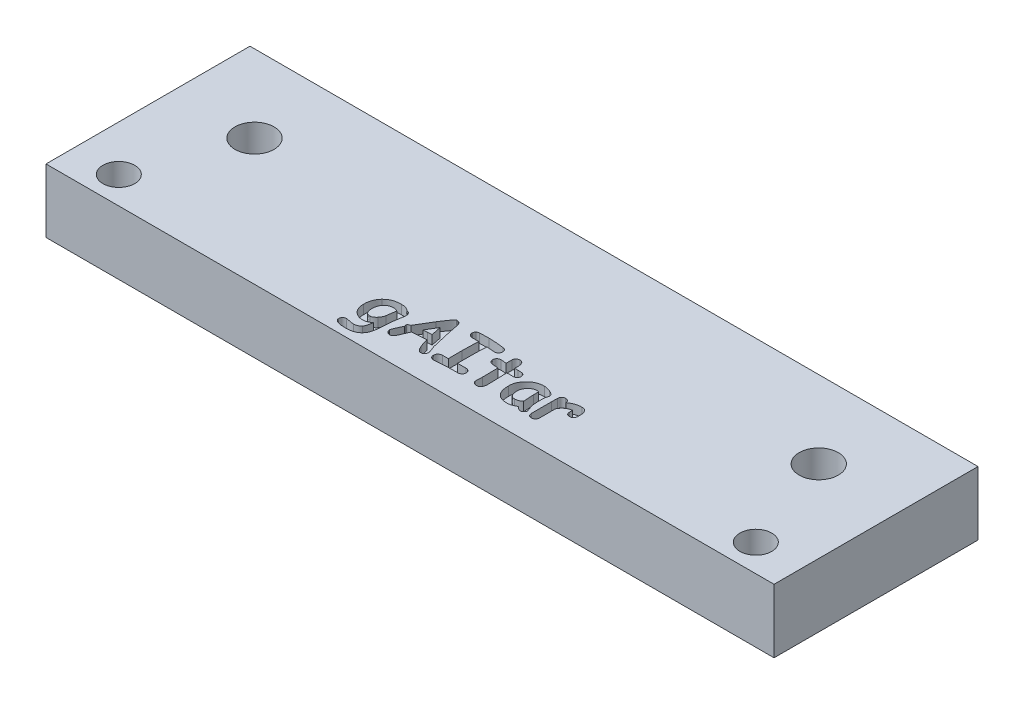
from build123d import *

# Parameters (mm, degrees)
SKETCH1_R           = 1.75
SKETCH1_R_2         = 2.15
BOSS_EXTRUDE1_DEPTH = 7
CUT_EXTRUDE1_DEPTH  = 1


with BuildPart() as part:
    # Sketch1 → Boss-Extrude1 (new body)
    with BuildSketch(Plane(origin=(0, 0, 0), x_dir=(1, 0, 0), z_dir=(0, 1, 0))):
        Polygon((13.670445698, -14.868638902), (-5.262861358, -14.868638902), (-5.262861358, -30.868638902), (-5.262861358, -37.280752379), (74.737138642, -37.280752379), (74.737138642, -14.868638902), (63.356369804, -14.868638902), align=None)
        with Locations((-0.262861358, -34.280752379)):
            Circle(SKETCH1_R, mode=Mode.SUBTRACT)
        with Locations((69.737138642, -34.280752379)):
            Circle(SKETCH1_R, mode=Mode.SUBTRACT)
        with Locations((3.737138642, -23.368638902)):
            Circle(SKETCH1_R_2, mode=Mode.SUBTRACT)
        with Locations((65.737138642, -23.368638902)):
            Circle(SKETCH1_R_2, mode=Mode.SUBTRACT)
    extrude(amount=-BOSS_EXTRUDE1_DEPTH)

    # Sketch2 → Cut-Extrude1 (cut)
    # profile 1 of 6: a face of its own
    with BuildSketch(Plane(origin=(0, 0, 0), x_dir=(1, 0, 0), z_dir=(0, 1, 0))):
        with BuildLine():
            add(Edge.make_bspline(
                [(28.877942793, -32.540894307), (28.854196843, -32.673953942), (28.806150163, -32.943181901), (28.756806812, -33.35489831), (28.717322684, -33.776893115), (28.705414659, -34.062125424), (28.699392645, -34.20637041)],
                knots=[0, 0, 0, 0, 0.967219611, 1.957036499, 2.966851822, 4, 4, 4, 4], degree=3))
            add(Edge.make_bspline(
                [(28.699392645, -34.20637041), (28.695835472, -34.293705449), (28.688967863, -34.462317677), (28.66700685, -34.705919532), (28.636730362, -34.931090951), (28.597753156, -35.138010913), (28.548415725, -35.32603197), (28.489788382, -35.495464519), (28.423852115, -35.647606206), (28.368742547, -35.738131355), (28.342292349, -35.781579494)],
                knots=[0, 0, 0, 0, 1.28398527, 2.478909032, 3.591840689, 4.620754995, 5.570443612, 6.444572228, 7.253462258, 8, 8, 8, 8], degree=3))
            add(Edge.make_bspline(
                [(28.342292349, -35.781579494), (28.304156717, -35.834120572), (28.228319149, -35.93860521), (28.08648839, -36.07296206), (27.924012281, -36.185281957), (27.741415791, -36.278633239), (27.537219472, -36.349224454), (27.31309504, -36.400339071), (27.06817942, -36.431391059), (26.898115345, -36.434597207), (26.809736912, -36.43626337)],
                knots=[0, 0, 0, 0, 0.894508824, 1.778844928, 2.680171894, 3.61283656, 4.600026264, 5.653829217, 6.780748383, 8, 8, 8, 8], degree=3))
            add(Edge.make_bspline(
                [(26.809736912, -36.43626337), (26.757822527, -36.435865226), (26.65726388, -36.435094018), (26.511633725, -36.429685898), (26.376108667, -36.418024576), (26.250493435, -36.40523917), (26.135011767, -36.386120244), (26.029697641, -36.363469033), (25.93389223, -36.337336662), (25.848744625, -36.305110889), (25.7722405, -36.271205713), (25.706915296, -36.231051948), (25.650032596, -36.188884639), (25.604453101, -36.140433156), (25.569924709, -36.087279093), (25.543039988, -36.031277274), (25.527858641, -35.970176707), (25.526080351, -35.928137653), (25.525167791, -35.906564597)],
                knots=[0, 0, 0, 0, 1.636202728, 3.169339922, 4.591200698, 5.922662832, 7.147586717, 8.277898332, 9.317111446, 10.273332431, 11.145263722, 11.949492425, 12.685250108, 13.370889905, 14.032756056, 14.676152522, 15.320645135, 16, 16, 16, 16], degree=3))
            add(Edge.make_bspline(
                [(25.525167791, -35.906564597), (25.526215877, -35.87629543), (25.528227825, -35.818189517), (25.551639504, -35.736146405), (25.585673774, -35.661923106), (25.636625425, -35.599198201), (25.697788314, -35.547064507), (25.769772825, -35.510032387), (25.85046819, -35.487192991), (25.907236411, -35.485091336), (25.936825077, -35.483995914)],
                knots=[0, 0, 0, 0, 1.091645385, 2.095566482, 3.063871764, 4.025877491, 4.993739444, 5.951348175, 6.932204115, 8, 8, 8, 8], degree=3))
            add(Edge.make_bspline(
                [(25.936825077, -35.483995914), (25.963638071, -35.484919846), (26.023093997, -35.4869686), (26.119754504, -35.499958035), (26.232260846, -35.519849823), (26.355963241, -35.548043262), (26.484090778, -35.575933949), (26.609257658, -35.595667814), (26.726478353, -35.608437094), (26.802102599, -35.610143535), (26.838503324, -35.610964908)],
                knots=[0, 0, 0, 0, 0.705402751, 1.564180905, 2.562339674, 3.710518732, 4.901234271, 6.010912507, 7.042579196, 8, 8, 8, 8], degree=3))
            add(Edge.make_bspline(
                [(26.838503324, -35.610964908), (26.877567932, -35.610011313), (26.953309544, -35.608162407), (27.062525339, -35.594017403), (27.164376647, -35.571929801), (27.25734991, -35.537443735), (27.344008004, -35.49628974), (27.421574401, -35.443913826), (27.492510687, -35.383376968), (27.531879254, -35.335510928), (27.551711971, -35.311397437)],
                knots=[0, 0, 0, 0, 1.167774304, 2.264175006, 3.288380824, 4.27673725, 5.223050921, 6.149949896, 7.067999611, 8, 8, 8, 8], degree=3))
            add(Edge.make_bspline(
                [(27.551711971, -35.311397437), (27.569896668, -35.285681108), (27.60765942, -35.232277999), (27.653002314, -35.141279861), (27.694315296, -35.040298892), (27.727996695, -34.928090612), (27.758259393, -34.805399974), (27.781516807, -34.671465868), (27.799232941, -34.52642129), (27.806731843, -34.425959905), (27.810609686, -34.37400916)],
                knots=[0, 0, 0, 0, 0.766248492, 1.591208865, 2.469199973, 3.42203185, 4.441793224, 5.54621718, 6.731096096, 8, 8, 8, 8], degree=3))
            add(Edge.make_bspline(
                [(27.810609686, -34.37400916), (27.782698885, -34.401695192), (27.727347747, -34.456600581), (27.636014673, -34.528050168), (27.538772831, -34.587668052), (27.437572584, -34.637986756), (27.330231435, -34.675859988), (27.218052679, -34.701888829), (27.10129262, -34.720035356), (27.021753856, -34.72145877), (26.981343443, -34.722181949)],
                knots=[0, 0, 0, 0, 1.018488561, 2.019809537, 2.997408571, 3.971054348, 4.944285044, 5.940088247, 6.953442572, 8, 8, 8, 8], degree=3))
            add(Edge.make_bspline(
                [(26.981343443, -34.722181949), (26.928715985, -34.720777789), (26.825393462, -34.718021028), (26.67399483, -34.698437024), (26.530566129, -34.66336396), (26.394723539, -34.615394255), (26.265617077, -34.555215108), (26.145466336, -34.478931655), (26.032337381, -34.389967924), (25.927914025, -34.28800268), (25.833018923, -34.176043267), (25.751475247, -34.054333172), (25.680007527, -33.926616585), (25.624071676, -33.789363081), (25.578603755, -33.64556891), (25.549151631, -33.493399956), (25.527776408, -33.334724057), (25.526047619, -33.226074351), (25.525167791, -33.170779552)],
                knots=[0, 0, 0, 0, 1.057394421, 2.07596308, 3.060530534, 4.018719327, 4.966765821, 5.91609184, 6.871743602, 7.853707326, 8.843885278, 9.815000739, 10.793294062, 11.779138416, 12.787821841, 13.818474559, 14.889762197, 16, 16, 16, 16], degree=3))
            add(Edge.make_bspline(
                [(25.525167791, -33.170779552), (25.526887554, -33.096306694), (25.530261295, -32.950209702), (25.556533664, -32.736791613), (25.59873183, -32.534061071), (25.659225728, -32.342452474), (25.738560907, -32.162235251), (25.832463145, -31.991635336), (25.944982803, -31.832194811), (26.033254821, -31.736816392), (26.077681305, -31.688813323)],
                knots=[0, 0, 0, 0, 1.100769952, 2.159433455, 3.17379743, 4.158601115, 5.124007861, 6.080262211, 7.033813857, 8, 8, 8, 8], degree=3))
            add(Edge.make_bspline(
                [(26.077681305, -31.688813323), (26.126623805, -31.642038529), (26.223993806, -31.54898113), (26.387583037, -31.429806694), (26.562833435, -31.327778035), (26.751348872, -31.245446265), (26.952265678, -31.18185141), (27.165544243, -31.136712361), (27.391232899, -31.108125262), (27.546002792, -31.105107959), (27.625115921, -31.103565616)],
                knots=[0, 0, 0, 0, 0.954478493, 1.898913427, 2.848073813, 3.811237561, 4.795497314, 5.816828307, 6.884036558, 8, 8, 8, 8], degree=3))
            add(Edge.make_bspline(
                [(27.625115921, -31.103565616), (27.675732098, -31.104560502), (27.773198918, -31.106476261), (27.914326626, -31.119895566), (28.044017457, -31.144722103), (28.1634328, -31.178290006), (28.271952343, -31.221458981), (28.369629058, -31.275733024), (28.45670153, -31.339917156), (28.506269461, -31.390857667), (28.530761949, -31.416028375)],
                knots=[0, 0, 0, 0, 1.230633783, 2.369715889, 3.441839262, 4.436769147, 5.381727131, 6.274208347, 7.147252447, 8, 8, 8, 8], degree=3))
            add(Edge.make_bspline(
                [(28.530761949, -31.416028375), (28.56412149, -31.42109757), (28.627553929, -31.430736535), (28.714583395, -31.46367469), (28.78972595, -31.506896655), (28.850939812, -31.564983183), (28.897308072, -31.636572375), (28.929698255, -31.720321457), (28.949743161, -31.81617478), (28.952092305, -31.884119952), (28.953330633, -31.91993657)],
                knots=[0, 0, 0, 0, 1.09924587, 2.090192013, 3.019932431, 3.913665009, 4.81822796, 5.78281411, 6.831232632, 8, 8, 8, 8], degree=3))
            add(Edge.make_bspline(
                [(28.953330633, -31.91993657), (28.952146673, -31.960964891), (28.949572935, -32.050153848), (28.93454218, -32.194803585), (28.910557112, -32.360819589), (28.889249419, -32.478466591), (28.877942793, -32.540894307)],
                knots=[0, 0, 0, 0, 0.786268973, 1.709222005, 2.784431082, 4, 4, 4, 4], degree=3))
        make_face()
        with BuildLine():
            add(Edge.make_bspline(
                [(27.56659115, -31.865379581), (27.520897879, -31.866438657), (27.432118229, -31.868496386), (27.302839553, -31.886893976), (27.181391398, -31.916335625), (27.06739643, -31.957997772), (26.961687428, -32.012408784), (26.862456622, -32.076515818), (26.772331692, -32.154971826), (26.719478595, -32.214911306), (26.69268737, -32.245294618)],
                knots=[0, 0, 0, 0, 1.111238106, 2.159077864, 3.169787664, 4.147162423, 5.104195285, 6.056958229, 7.015072484, 8, 8, 8, 8], degree=3))
            add(Edge.make_bspline(
                [(26.69268737, -32.245294618), (26.670222313, -32.274607183), (26.625110774, -32.333469041), (26.568683583, -32.430563617), (26.521696421, -32.533923157), (26.480705607, -32.642858454), (26.452158703, -32.758926344), (26.430185117, -32.880815208), (26.41555868, -33.00907014), (26.414495131, -33.097003963), (26.41395075, -33.142013139)],
                knots=[0, 0, 0, 0, 0.924915228, 1.857300009, 2.806547696, 3.768766156, 4.769746137, 5.797102952, 6.872440935, 8, 8, 8, 8], degree=3))
            add(Edge.make_bspline(
                [(26.41395075, -33.142013139), (26.414223247, -33.175091726), (26.414749831, -33.23901425), (26.421850576, -33.331757851), (26.433363121, -33.417972092), (26.450416552, -33.497773343), (26.471296862, -33.571312332), (26.495229735, -33.639403995), (26.526734343, -33.699997687), (26.561304149, -33.755246201), (26.600972494, -33.804231754), (26.645911755, -33.845995073), (26.695443236, -33.881633978), (26.750140152, -33.909882252), (26.808830778, -33.933163075), (26.87257302, -33.948767141), (26.940667904, -33.959026479), (26.987916632, -33.959913895), (27.012093746, -33.960367984)],
                knots=[0, 0, 0, 0, 1.37461971, 2.65637591, 3.863376246, 4.987402158, 6.044576246, 7.040288866, 7.980686288, 8.876649525, 9.745970185, 10.591946157, 11.419525468, 12.274054161, 13.144352013, 14.037676177, 14.995881405, 16, 16, 16, 16], degree=3))
            add(Edge.make_bspline(
                [(27.012093746, -33.960367984), (27.035019407, -33.959534524), (27.081094772, -33.957859458), (27.149436886, -33.940123073), (27.218547523, -33.915948552), (27.286972543, -33.879200372), (27.356099105, -33.833464902), (27.42382951, -33.775837691), (27.494234949, -33.711012696), (27.537326333, -33.660944897), (27.559647533, -33.635009936)],
                knots=[0, 0, 0, 0, 0.835668678, 1.679503976, 2.56600849, 3.506113926, 4.507836105, 5.588931544, 6.751074222, 8, 8, 8, 8], degree=3))
            add(Edge.make_bspline(
                [(27.559647533, -33.635009936), (27.599829018, -33.58478111), (27.676709488, -33.488676753), (27.763963056, -33.333776212), (27.828525089, -33.181333794), (27.846515602, -33.076726335), (27.855247223, -33.025955543)],
                knots=[0, 0, 0, 0, 1.123174621, 2.149004495, 3.101627094, 4, 4, 4, 4], degree=3))
            add(Edge.make_bspline(
                [(27.855247223, -33.025955543), (27.860580778, -32.996535701), (27.871897159, -32.934114644), (27.888912402, -32.834990839), (27.905600452, -32.724135401), (27.923143748, -32.602081561), (27.942567757, -32.468289936), (27.960799418, -32.323005644), (27.980794396, -32.166298982), (27.994157711, -32.058152502), (28.001063177, -32.002268027)],
                knots=[0, 0, 0, 0, 0.693869833, 1.47220668, 2.333871874, 3.295331016, 4.333835031, 5.471190016, 6.69324256, 8, 8, 8, 8], degree=3))
            add(Edge.make_bspline(
                [(28.001063177, -32.002268027), (27.964183764, -31.981414951), (27.892722474, -31.941007915), (27.781348127, -31.899037579), (27.673103957, -31.871040303), (27.601466585, -31.867233068), (27.56659115, -31.865379581)],
                knots=[0, 0, 0, 0, 1.102033903, 2.135412693, 3.092257404, 4, 4, 4, 4], degree=3))
        make_face(mode=Mode.SUBTRACT)
    # profile 2 of 6: a face of its own
    with BuildSketch(Plane(origin=(0, 0, 0), x_dir=(1, 0, 0), z_dir=(0, 1, 0))):
        with BuildLine():
            add(Edge.make_bspline(
                [(33.235558349, -34.658697452), (33.213085251, -34.655922999), (33.16579916, -34.650085219), (33.097271021, -34.615554786), (33.030235064, -34.561916936), (32.963029355, -34.489879395), (32.897121064, -34.398047027), (32.829245877, -34.288319318), (32.762560867, -34.158249172), (32.720891322, -34.063762617), (32.69891596, -34.013933028)],
                knots=[0, 0, 0, 0, 0.617601942, 1.299508468, 2.069050832, 2.967653557, 3.993005483, 5.166409531, 6.505642971, 8, 8, 8, 8], degree=3))
            add(Edge.make_bspline(
                [(32.69891596, -34.013933028), (32.668678952, -33.943492327), (32.606585779, -33.798838907), (32.526783724, -33.570030748), (32.450362887, -33.326862355), (32.407460463, -33.158114419), (32.385461256, -33.071585025)],
                knots=[0, 0, 0, 0, 0.92482678, 1.899176974, 2.922754564, 4, 4, 4, 4], degree=3))
            add(Edge.make_bspline(
                [(32.385461256, -33.071585025), (32.36363523, -33.073866414), (32.317005321, -33.078740457), (32.242399118, -33.087273102), (32.15832511, -33.093696494), (32.064713346, -33.100408642), (31.961646204, -33.109065639), (31.848457362, -33.115080095), (31.725875988, -33.123821145), (31.640851197, -33.127965678), (31.596864769, -33.130109796)],
                knots=[0, 0, 0, 0, 0.665943065, 1.422744785, 2.27850244, 3.224288394, 4.27088324, 5.416887377, 6.663661535, 8, 8, 8, 8], degree=3))
            add(Edge.make_bspline(
                [(31.596864769, -33.130109796), (31.516163053, -33.134731794), (31.364592773, -33.143412621), (31.152339007, -33.160602013), (30.970009215, -33.177564735), (30.858825843, -33.191993113), (30.808268282, -33.198554019)],
                knots=[0, 0, 0, 0, 1.225077394, 2.300884464, 3.227374231, 4, 4, 4, 4], degree=3))
            add(Edge.make_bspline(
                [(30.808268282, -33.198554019), (30.794828271, -33.233978441), (30.766337857, -33.309071865), (30.718530049, -33.427528059), (30.662480037, -33.557981144), (30.601285389, -33.702087319), (30.53283589, -33.85848883), (30.457418118, -34.027594291), (30.373912335, -34.208408395), (30.316260097, -34.333338097), (30.286505071, -34.397815847)],
                knots=[0, 0, 0, 0, 0.695126249, 1.473543035, 2.343390057, 3.300056381, 4.345961424, 5.475616407, 6.697134707, 8, 8, 8, 8], degree=3))
            add(Edge.make_bspline(
                [(30.286505071, -34.397815847), (30.274140753, -34.418677312), (30.250255572, -34.458977139), (30.206859834, -34.511721017), (30.161143903, -34.556843152), (30.111883342, -34.594654701), (30.058051877, -34.623098439), (30.001157607, -34.644437967), (29.940493029, -34.656515609), (29.899037255, -34.657958897), (29.877823621, -34.658697452)],
                knots=[0, 0, 0, 0, 1.138689991, 2.199702202, 3.200101217, 4.154635026, 5.107521665, 6.051873488, 7.003110107, 8, 8, 8, 8], degree=3))
            add(Edge.make_bspline(
                [(29.877823621, -34.658697452), (29.847572379, -34.657222098), (29.787753699, -34.654304741), (29.700873959, -34.629343161), (29.619184688, -34.588638315), (29.544140857, -34.533985775), (29.478779045, -34.467283044), (29.431795607, -34.388769825), (29.401991228, -34.301362121), (29.399175264, -34.240012953), (29.397722112, -34.208354301)],
                knots=[0, 0, 0, 0, 0.992623025, 1.962808613, 2.944427404, 3.978985964, 5.001144528, 5.990670065, 6.963104482, 8, 8, 8, 8], degree=3))
            add(Edge.make_bspline(
                [(29.397722112, -34.208354301), (29.398197287, -34.200064303), (29.399289314, -34.181012577), (29.406068315, -34.149684959), (29.414659948, -34.111812385), (29.428081742, -34.067922709), (29.444924592, -34.017313403), (29.46592299, -33.960277163), (29.489485224, -33.89656729), (29.517656287, -33.826942963), (29.549317512, -33.750524182), (29.585177114, -33.667735674), (29.62336015, -33.577940046), (29.667763538, -33.483015774), (29.714304145, -33.380811795), (29.763302797, -33.271443227), (29.818377864, -33.156924541), (29.855707718, -33.07821532), (29.874847786, -33.037858886)],
                knots=[0, 0, 0, 0, 0.314055115, 0.721748328, 1.210755772, 1.785277686, 2.458454997, 3.230882768, 4.086800385, 5.030877746, 6.075036811, 7.219431389, 8.447692371, 9.770074371, 11.187795077, 12.700857956, 14.30843697, 16, 16, 16, 16], degree=3))
            add(Edge.make_bspline(
                [(29.874847786, -33.037858886), (29.861734206, -33.004229741), (29.837071083, -32.940982345), (29.835776308, -32.87319704), (29.835169975, -32.841453723)],
                knots=[0, 0, 0, 0, 1.06341596, 2, 2, 2, 2], degree=3))
            add(Edge.make_bspline(
                [(29.835169975, -32.841453723), (29.83715775, -32.828046189), (29.841129712, -32.801255315), (29.859313247, -32.763472656), (29.88607645, -32.728030181), (29.921555436, -32.694707703), (29.96695822, -32.664724608), (30.020447717, -32.636274244), (30.083036467, -32.609314591), (30.128633408, -32.595024504), (30.15259246, -32.587515735)],
                knots=[0, 0, 0, 0, 0.752598618, 1.503839162, 2.308249816, 3.221830668, 4.204347205, 5.335203325, 6.599774453, 8, 8, 8, 8], degree=3))
            add(Edge.make_bspline(
                [(30.15259246, -32.587515735), (30.231423481, -32.447348907), (30.391344152, -32.162999259), (30.64431192, -31.736392074), (30.907176387, -31.300193503), (31.091084651, -31.009652482), (31.184215538, -30.862522916)],
                knots=[0, 0, 0, 0, 0.959952368, 1.947408831, 2.960570711, 4, 4, 4, 4], degree=3))
            add(Edge.make_bspline(
                [(31.184215538, -30.862522916), (31.217099316, -30.810494261), (31.280851486, -30.709625693), (31.376479011, -30.564934089), (31.466866571, -30.429774946), (31.551859782, -30.304473204), (31.630997039, -30.188204561), (31.707715618, -30.08399507), (31.777822594, -29.988270602), (31.843469979, -29.903090817), (31.903297517, -29.827123076), (31.960625012, -29.762915863), (32.01111064, -29.70684619), (32.058565988, -29.66274709), (32.098467449, -29.625147234), (32.136209533, -29.60111765), (32.168177992, -29.583842409), (32.188916016, -29.581125597), (32.1979836, -29.579937686)],
                knots=[0, 0, 0, 0, 1.78782162, 3.46607086, 5.037735172, 6.510873904, 7.864269361, 9.122617283, 10.269431075, 11.310632428, 12.246624243, 13.076963133, 13.810944874, 14.435907806, 14.959952405, 15.396829301, 15.736266982, 16, 16, 16, 16], degree=3))
            add(Edge.make_bspline(
                [(32.1979836, -29.579937686), (32.228198034, -29.581159141), (32.286434526, -29.583513421), (32.370152837, -29.604924833), (32.445134893, -29.641325836), (32.513508541, -29.690659032), (32.571711746, -29.755875543), (32.624379663, -29.832991266), (32.666444462, -29.92567341), (32.687746456, -29.992996635), (32.69891596, -30.028296947)],
                knots=[0, 0, 0, 0, 0.99262844, 1.913231282, 2.818023045, 3.720786198, 4.667487244, 5.678007641, 6.782484758, 8, 8, 8, 8], degree=3))
            add(Edge.make_bspline(
                [(32.69891596, -30.028296947), (32.704808779, -30.060050457), (32.717339507, -30.127572402), (32.738446869, -30.234255361), (32.760968037, -30.352749286), (32.787095376, -30.482232375), (32.814440867, -30.62323987), (32.845636158, -30.774852192), (32.878094052, -30.937984513), (32.901207691, -31.050344397), (32.913176138, -31.108525342)],
                knots=[0, 0, 0, 0, 0.703804664, 1.496598655, 2.369949713, 3.332312584, 4.375228356, 5.500107119, 6.705533268, 8, 8, 8, 8], degree=3))
            add(Edge.make_bspline(
                [(32.913176138, -31.108525342), (32.931074412, -31.190847205), (32.967518604, -31.358469722), (33.02229726, -31.614377957), (33.082692092, -31.87822508), (33.143880396, -32.151485062), (33.208234647, -32.433558163), (33.275678925, -32.724202097), (33.346362889, -33.023379985), (33.394566849, -33.225675147), (33.419068224, -33.328498849)],
                knots=[0, 0, 0, 0, 0.887984091, 1.808099605, 2.758450469, 3.740933003, 4.759716727, 5.808016423, 6.885846477, 8, 8, 8, 8], degree=3))
            add(Edge.make_bspline(
                [(33.419068224, -33.328498849), (33.421631011, -33.337782168), (33.427533411, -33.359162734), (33.439782742, -33.394788748), (33.455437577, -33.438193712), (33.476001602, -33.489502246), (33.499345643, -33.549067428), (33.526005027, -33.617173934), (33.558091525, -33.692290248), (33.580748465, -33.745119387), (33.592658645, -33.772890329)],
                knots=[0, 0, 0, 0, 0.484095073, 1.11492746, 1.893238178, 2.803918041, 3.893639273, 5.109913091, 6.480754429, 8, 8, 8, 8], degree=3))
            add(Edge.make_bspline(
                [(33.592658645, -33.772890329), (33.611160977, -33.81795666), (33.645239289, -33.90096158), (33.683228868, -34.018937349), (33.708323585, -34.118714237), (33.71272017, -34.180146899), (33.714667913, -34.207362355)],
                knots=[0, 0, 0, 0, 1.288345925, 2.372925573, 3.279185206, 4, 4, 4, 4], degree=3))
            add(Edge.make_bspline(
                [(33.714667913, -34.207362355), (33.713107891, -34.238663553), (33.710037989, -34.300259879), (33.681008737, -34.38806705), (33.633882952, -34.467791259), (33.570011706, -34.536479059), (33.495104561, -34.593193592), (33.412833497, -34.63309552), (33.325609111, -34.657783385), (33.265809255, -34.658390388), (33.235558349, -34.658697452)],
                knots=[0, 0, 0, 0, 1.02219752, 2.011540054, 2.991779931, 4.033789213, 5.062158375, 6.049782013, 7.01344477, 8, 8, 8, 8], degree=3))
        make_face()
        with BuildLine():
            add(Edge.make_bspline(
                [(31.962892572, -31.184905128), (31.940083643, -31.222933217), (31.8924824, -31.302296188), (31.817986798, -31.426228938), (31.738121758, -31.560303444), (31.650024121, -31.703115187), (31.557210217, -31.856796891), (31.458200348, -32.020249344), (31.352615291, -32.1934437), (31.280114464, -32.31209226), (31.242740309, -32.373255557)],
                knots=[0, 0, 0, 0, 0.765904334, 1.598409045, 2.497514132, 3.461292612, 4.496548288, 5.59840364, 6.761977782, 8, 8, 8, 8], degree=3))
            add(Edge.make_bspline(
                [(31.242740309, -32.373255557), (31.271493621, -32.369521639), (31.335515792, -32.36120769), (31.442240508, -32.349782814), (31.570071468, -32.343179353), (31.662336832, -32.338224774), (31.71193042, -32.335561637)],
                knots=[0, 0, 0, 0, 0.7389037, 1.645244125, 2.734294355, 4, 4, 4, 4], degree=3))
            add(Edge.make_bspline(
                [(31.71193042, -32.335561637), (31.742020216, -32.334258402), (31.799229947, -32.331780562), (31.880578357, -32.327958139), (31.953282168, -32.323562699), (32.0174642, -32.320972205), (32.073009618, -32.317910808), (32.1196502, -32.315151149), (32.157624746, -32.31181437), (32.180125964, -32.310396347), (32.190048038, -32.30977106)],
                knots=[0, 0, 0, 0, 1.509561724, 2.870129807, 4.081743534, 5.160108469, 6.089504161, 6.870000916, 7.50171875, 8, 8, 8, 8], degree=3))
            add(Edge.make_bspline(
                [(32.190048038, -32.30977106), (32.182709621, -32.272420168), (32.167519966, -32.195108246), (32.145162681, -32.074535266), (32.119121851, -31.94602406), (32.091177844, -31.809568376), (32.062888541, -31.664843101), (32.030304669, -31.512391009), (31.998591149, -31.35101844), (31.974964924, -31.241080431), (31.962892572, -31.184905128)],
                knots=[0, 0, 0, 0, 0.796061286, 1.647752555, 2.564499405, 3.538207678, 4.560733012, 5.648383233, 6.798388398, 8, 8, 8, 8], degree=3))
        make_face(mode=Mode.SUBTRACT)
    # profile 3 of 6: a face of its own
    with BuildSketch(Plane(origin=(0, 0, 0), x_dir=(1, 0, 0), z_dir=(0, 1, 0))):
        with BuildLine():
            add(Edge.make_bspline(
                [(37.268807804, -30.532205142), (37.252272893, -30.531957349), (37.213563435, -30.531377247), (37.146772385, -30.528022193), (37.062456369, -30.523051082), (36.960287926, -30.516013995), (36.840264568, -30.507044342), (36.702712621, -30.496141421), (36.54764323, -30.483177666), (36.438546891, -30.473712133), (36.38101679, -30.468720645)],
                knots=[0, 0, 0, 0, 0.445813027, 1.043681475, 1.802721911, 2.723031118, 3.80466259, 5.047648995, 6.443127856, 8, 8, 8, 8], degree=3))
            add(Edge.make_bspline(
                [(36.38101679, -30.468720645), (36.376156077, -30.522598524), (36.366024455, -30.634901029), (36.354963277, -30.809912687), (36.343193677, -30.99765482), (36.336312134, -31.198118174), (36.32846523, -31.41134925), (36.325478824, -31.637229366), (36.321910669, -31.87594946), (36.321639498, -32.039298856), (36.321500074, -32.12328535)],
                knots=[0, 0, 0, 0, 0.783875404, 1.633901941, 2.541011057, 3.50963479, 4.54033398, 5.632943764, 6.782972208, 8, 8, 8, 8], degree=3))
            Line((36.321500074, -32.12328535), (36.317532293, -33.642945499))
            add(Edge.make_bspline(
                [(36.317532293, -33.642945499), (36.469955875, -33.639805985), (36.777756784, -33.63346612), (37.085623028, -33.633173673), (37.241033336, -33.633026046)],
                knots=[0, 0, 0, 0, 0.990403717, 2, 2, 2, 2], degree=3))
            add(Edge.make_bspline(
                [(37.241033336, -33.633026046), (37.273952602, -33.634313678), (37.337511462, -33.636799774), (37.428256671, -33.662874302), (37.510319106, -33.704882895), (37.580640492, -33.764113391), (37.640839134, -33.832175579), (37.682604017, -33.910514288), (37.710622821, -33.99484723), (37.712982467, -34.054039225), (37.714191229, -34.084361142)],
                knots=[0, 0, 0, 0, 1.082052957, 2.089173409, 3.083186474, 4.097294582, 5.101700896, 6.05723862, 7.004793642, 8, 8, 8, 8], degree=3))
            add(Edge.make_bspline(
                [(37.714191229, -34.084361142), (37.712384579, -34.114283345), (37.708846495, -34.172882036), (37.683349659, -34.257990383), (37.63860033, -34.334810698), (37.578711728, -34.403060375), (37.507162885, -34.460949206), (37.42375185, -34.501921139), (37.33185584, -34.527882927), (37.267335467, -34.53042077), (37.23408972, -34.531728458)],
                knots=[0, 0, 0, 0, 0.981990313, 1.923098611, 2.885936941, 3.87867145, 4.890923925, 5.886267153, 6.910845923, 8, 8, 8, 8], degree=3))
            add(Edge.make_bspline(
                [(37.23408972, -34.531728458), (37.197717239, -34.531586157), (37.11703153, -34.53127049), (36.983795027, -34.534218824), (36.826380739, -34.535187935), (36.652825741, -34.540214935), (36.479540889, -34.542076832), (36.322506729, -34.54605818), (36.189569162, -34.546400648), (36.108892643, -34.54722703), (36.072521812, -34.547599582)],
                knots=[0, 0, 0, 0, 0.75140939, 1.666864596, 2.753078635, 4.003449207, 5.253689156, 6.333180816, 7.248559561, 8, 8, 8, 8], degree=3))
            add(Edge.make_bspline(
                [(36.072521812, -34.547599582), (36.052352937, -34.547909932), (36.009694024, -34.548566349), (35.941841258, -34.550043431), (35.86685545, -34.555864593), (35.784454403, -34.561235381), (35.69525761, -34.569813705), (35.598888357, -34.577943188), (35.495560077, -34.590778028), (35.387392638, -34.60291631), (35.279059053, -34.616227316), (35.175464927, -34.62655225), (35.079319224, -34.636881273), (34.990368407, -34.644856638), (34.908361434, -34.650975539), (34.833260272, -34.65453743), (34.765500093, -34.658090119), (34.722819012, -34.658502524), (34.702645399, -34.658697452)],
                knots=[0, 0, 0, 0, 0.704160305, 1.489359833, 2.368452763, 3.328943639, 4.371824874, 5.496213545, 6.704552097, 8.005941836, 9.295867175, 10.514415829, 11.63992951, 12.67131452, 13.631805396, 14.510216124, 15.295839695, 16, 16, 16, 16], degree=3))
            add(Edge.make_bspline(
                [(34.702645399, -34.658697452), (34.669399608, -34.657031214), (34.604816187, -34.653794375), (34.512162107, -34.627031563), (34.428642369, -34.582912294), (34.356267373, -34.521860117), (34.297152185, -34.449035927), (34.25324556, -34.367429026), (34.227883251, -34.277948244), (34.224348534, -34.216115975), (34.22254389, -34.184547614)],
                knots=[0, 0, 0, 0, 1.059674382, 2.058528156, 3.049994519, 4.054020422, 5.059487538, 6.027361096, 6.992872509, 8, 8, 8, 8], degree=3))
            add(Edge.make_bspline(
                [(34.22254389, -34.184547614), (34.224157438, -34.152595628), (34.227327377, -34.089823509), (34.255489115, -34.00011529), (34.299941485, -33.917330953), (34.362784832, -33.845175494), (34.437593343, -33.783191236), (34.524206432, -33.737670911), (34.620793103, -33.711439956), (34.687936917, -33.708132021), (34.722484304, -33.706429996)],
                knots=[0, 0, 0, 0, 0.992985397, 1.95079569, 2.900097383, 3.900955296, 4.911042762, 5.910628263, 6.924959263, 8, 8, 8, 8], degree=3))
            add(Edge.make_bspline(
                [(34.722484304, -33.706429996), (34.766460544, -33.706429996), (34.860695345, -33.706429996), (35.011801674, -33.706429996), (35.182085611, -33.706429996), (35.302110988, -33.706429996), (35.365264837, -33.706429996)],
                knots=[0, 0, 0, 0, 0.820987654, 1.759259259, 2.820987654, 4, 4, 4, 4], degree=3))
            add(Edge.make_bspline(
                [(35.365264837, -33.706429996), (35.364511819, -33.669067888), (35.362859295, -33.587075398), (35.362322094, -33.452491049), (35.361196517, -33.295104233), (35.360245326, -33.114569489), (35.359314094, -32.910890075), (35.358015335, -32.684397081), (35.358409471, -32.43475598), (35.358351518, -32.260835031), (35.35832122, -32.169906778)],
                knots=[0, 0, 0, 0, 0.5836817, 1.280910478, 2.102084751, 3.042040837, 4.100779199, 5.283464622, 6.57975812, 8, 8, 8, 8], degree=3))
            add(Edge.make_bspline(
                [(35.35832122, -32.169906778), (35.358866836, -32.017464216), (35.359945285, -31.716150158), (35.375043284, -31.269728718), (35.395669319, -30.833757721), (35.417802681, -30.547040105), (35.428749334, -30.405236148)],
                knots=[0, 0, 0, 0, 1.03546784, 2.04667918, 3.033932318, 4, 4, 4, 4], degree=3))
            Line((35.428749334, -30.405236148), (34.697685672, -30.405236148))
            add(Edge.make_bspline(
                [(34.697685672, -30.405236148), (34.665131956, -30.40376645), (34.602144129, -30.400922748), (34.51158525, -30.377218236), (34.428996951, -30.338461694), (34.357277453, -30.283619854), (34.296783195, -30.218506073), (34.253671242, -30.143151387), (34.227600026, -30.059725332), (34.224265293, -30.00170593), (34.22254389, -29.971756066)],
                knots=[0, 0, 0, 0, 1.087496504, 2.104184986, 3.108465136, 4.119361848, 5.105884215, 6.062056377, 6.999625195, 8, 8, 8, 8], degree=3))
            add(Edge.make_bspline(
                [(34.22254389, -29.971756066), (34.223877722, -29.941798043), (34.226477059, -29.883416636), (34.25227026, -29.800908996), (34.29358521, -29.726380659), (34.333240873, -29.686560614), (34.353480665, -29.666236924)],
                knots=[0, 0, 0, 0, 1.046658878, 2.039701267, 2.999486214, 4, 4, 4, 4], degree=3))
            add(Edge.make_bspline(
                [(34.353480665, -29.666236924), (34.374443248, -29.649260209), (34.416023906, -29.615585781), (34.488402012, -29.578471252), (34.567641076, -29.553408521), (34.623450452, -29.546027165), (34.65205619, -29.542243766)],
                knots=[0, 0, 0, 0, 0.982335062, 1.948525965, 2.948493336, 4, 4, 4, 4], degree=3))
            add(Edge.make_bspline(
                [(34.65205619, -29.542243766), (34.678168585, -29.540125364), (34.734976877, -29.535516719), (34.827292817, -29.531140789), (34.932743109, -29.525939444), (35.051450359, -29.521777526), (35.183409994, -29.520458291), (35.328892096, -29.518421514), (35.487597405, -29.515895522), (35.597709578, -29.516262529), (35.654912855, -29.516453189)],
                knots=[0, 0, 0, 0, 0.626560248, 1.363100493, 2.210219051, 3.151846138, 4.203777764, 5.366415193, 6.631852641, 8, 8, 8, 8], degree=3))
            add(Edge.make_bspline(
                [(35.654912855, -29.516453189), (35.710466599, -29.516860403), (35.825240583, -29.517701705), (36.003160384, -29.524052855), (36.192646053, -29.533998497), (36.394027651, -29.548014984), (36.606985662, -29.565877929), (36.831495405, -29.587883591), (37.067280086, -29.613537274), (37.228160937, -29.633307499), (37.310469505, -29.643422183)],
                knots=[0, 0, 0, 0, 0.802496017, 1.65795601, 2.571502426, 3.543419532, 4.573943291, 5.658517533, 6.802069544, 8, 8, 8, 8], degree=3))
            add(Edge.make_bspline(
                [(37.310469505, -29.643422183), (37.342146666, -29.648626944), (37.402793314, -29.658591576), (37.485767414, -29.68994583), (37.556758363, -29.730582156), (37.615386226, -29.782553274), (37.660684891, -29.846334591), (37.69228992, -29.921151494), (37.711509863, -30.006173961), (37.71326813, -30.066212565), (37.714191229, -30.097733115)],
                knots=[0, 0, 0, 0, 1.135697252, 2.174318321, 3.125291449, 4.021894543, 4.929465666, 5.87456831, 6.884138316, 8, 8, 8, 8], degree=3))
            add(Edge.make_bspline(
                [(37.714191229, -30.097733115), (37.712338292, -30.131025261), (37.708741971, -30.195641185), (37.679263419, -30.286989826), (37.6295168, -30.367726797), (37.58248112, -30.408968818), (37.558455822, -30.43003478)],
                knots=[0, 0, 0, 0, 1.048646388, 2.035292539, 2.99644947, 4, 4, 4, 4], degree=3))
            add(Edge.make_bspline(
                [(37.558455822, -30.43003478), (37.53678496, -30.445724093), (37.494447936, -30.476375334), (37.422730132, -30.508404001), (37.347377422, -30.52932078), (37.295068386, -30.531241092), (37.268807804, -30.532205142)],
                knots=[0, 0, 0, 0, 1.02328265, 1.999124094, 2.995504957, 4, 4, 4, 4], degree=3))
        make_face()
    # profile 4 of 6: a face of its own
    with BuildSketch(Plane(origin=(0, 0, 0), x_dir=(1, 0, 0), z_dir=(0, 1, 0))):
        with BuildLine():
            add(Edge.make_bspline(
                [(40.603727791, -31.849508456), (40.577601549, -31.849358625), (40.520693131, -31.849032261), (40.433442511, -31.844580349), (40.346195595, -31.84004498), (40.289617041, -31.839733046), (40.263490564, -31.839589004)],
                knots=[0, 0, 0, 0, 0.920858442, 2.00582231, 3.079141558, 4, 4, 4, 4], degree=3))
            add(Edge.make_bspline(
                [(40.263490564, -31.839589004), (40.212503888, -31.840695924), (40.102916162, -31.843075072), (39.994254481, -31.857608149), (39.936148626, -31.865379581)],
                knots=[0, 0, 0, 0, 0.930518006, 2, 2, 2, 2], degree=3))
            add(Edge.make_bspline(
                [(39.936148626, -31.865379581), (39.940951192, -31.971841327), (39.950122744, -32.175153398), (39.960518047, -32.465841199), (39.970314926, -32.727388083), (39.979940407, -32.960116859), (39.985739313, -33.163820366), (39.9894038, -33.338747292), (39.992959223, -33.48455153), (39.993458952, -33.572185196), (39.993681452, -33.61120325)],
                knots=[0, 0, 0, 0, 1.464153421, 2.796122304, 3.996273281, 5.060067093, 5.996274283, 6.796008021, 7.463934056, 8, 8, 8, 8], degree=3))
            add(Edge.make_bspline(
                [(39.993681452, -33.61120325), (39.993625631, -33.61980091), (39.993492492, -33.640307613), (39.994906863, -33.675674972), (39.995731003, -33.720646461), (39.99693329, -33.789093087), (39.998704809, -33.870425553), (39.999349577, -33.933584732), (39.999633123, -33.961359929)],
                knots=[0, 0, 0, 0, 0.441852835, 1.053885055, 1.818819149, 2.75366232, 4.572374303, 6, 6, 6, 6], degree=3))
            add(Edge.make_bspline(
                [(39.999633123, -33.961359929), (39.998414463, -34.020975704), (39.99612721, -34.132866133), (39.971717058, -34.288702353), (39.931753847, -34.421352414), (39.875471858, -34.531157396), (39.801480848, -34.618242581), (39.708973762, -34.679324545), (39.599923513, -34.716425546), (39.521824626, -34.720200967), (39.480845749, -34.722181949)],
                knots=[0, 0, 0, 0, 1.369472185, 2.570306781, 3.61362238, 4.541807732, 5.387671079, 6.209809855, 7.060678253, 8, 8, 8, 8], degree=3))
            add(Edge.make_bspline(
                [(39.480845749, -34.722181949), (39.448926941, -34.721110253), (39.386928599, -34.719028617), (39.298021024, -34.69509952), (39.214107132, -34.661998537), (39.165774812, -34.626736952), (39.141600467, -34.609100188)],
                knots=[0, 0, 0, 0, 1.048585908, 2.036748586, 3.018041825, 4, 4, 4, 4], degree=3))
            add(Edge.make_bspline(
                [(39.141600467, -34.609100188), (39.117272631, -34.589045268), (39.070606164, -34.550575249), (39.0213802, -34.476348269), (38.989075706, -34.395752823), (38.985633144, -34.338612386), (38.98388117, -34.309532718)],
                knots=[0, 0, 0, 0, 1.071670594, 2.055714289, 3.010522417, 4, 4, 4, 4], degree=3))
            add(Edge.make_bspline(
                [(38.98388117, -34.309532718), (38.984169079, -34.287047866), (38.984808471, -34.237113269), (38.986905826, -34.15478089), (38.989982774, -34.057573221), (38.993426, -33.950420479), (38.999037715, -33.843023142), (39.001585402, -33.745450988), (39.003801837, -33.662792514), (39.004429426, -33.612857458), (39.004712021, -33.590372399)],
                knots=[0, 0, 0, 0, 0.750078769, 1.665782836, 2.74716817, 3.994268432, 5.241807564, 6.334217164, 7.249921231, 8, 8, 8, 8], degree=3))
            add(Edge.make_bspline(
                [(39.004712021, -33.590372399), (39.0047636, -33.552017072), (39.004879654, -33.465716446), (39.003767426, -33.321881818), (39.001470274, -33.149290357), (38.999839012, -32.947917877), (38.996771058, -32.718117018), (38.992473782, -32.459559742), (38.988900792, -32.172215553), (38.98560668, -31.970855359), (38.98388117, -31.865379581)],
                knots=[0, 0, 0, 0, 0.533596536, 1.200608068, 2.001055743, 2.934895, 4.002177292, 5.198311057, 6.532429287, 8, 8, 8, 8], degree=3))
            add(Edge.make_bspline(
                [(38.98388117, -31.865379581), (38.943528545, -31.863266021), (38.85381441, -31.858567042), (38.705745274, -31.845864456), (38.530482911, -31.829805826), (38.370387325, -31.815316083), (38.238747402, -31.796105773), (38.149135286, -31.768877817), (38.073524549, -31.728837699), (38.011025542, -31.678265384), (37.962185442, -31.616434072), (37.928169852, -31.543089835), (37.908359171, -31.459053128), (37.905923033, -31.39960775), (37.90464472, -31.368415002)],
                knots=[0, 0, 0, 0, 1.084665642, 2.411487233, 3.988963346, 5.809257172, 6.727108064, 7.55525374, 8.309722526, 9.009810232, 9.698781128, 10.40553302, 11.16333603, 12, 12, 12, 12], degree=3))
            add(Edge.make_bspline(
                [(37.90464472, -31.368415002), (37.905896631, -31.337777893), (37.908353553, -31.277651434), (37.935979494, -31.19187548), (37.977789769, -31.112760057), (38.037201712, -31.043941382), (38.107915409, -30.984429047), (38.191959092, -30.942800228), (38.285344752, -30.916913794), (38.350841725, -30.914408823), (38.384746229, -30.913112125)],
                knots=[0, 0, 0, 0, 0.991476519, 1.945809358, 2.896935973, 3.87983014, 4.879238829, 5.877955247, 6.901523692, 8, 8, 8, 8], degree=3))
            add(Edge.make_bspline(
                [(38.384746229, -30.913112125), (38.397314297, -30.913355151), (38.426113284, -30.913912032), (38.474398319, -30.917165938), (38.53357541, -30.922283416), (38.603032833, -30.929096072), (38.683351073, -30.938322053), (38.773968633, -30.949083869), (38.875464886, -30.962101705), (38.946522575, -30.971601895), (38.98388117, -30.976596622)],
                knots=[0, 0, 0, 0, 0.500471998, 1.146802097, 1.926366169, 2.865667096, 3.925571924, 5.14544883, 6.49921911, 8, 8, 8, 8], degree=3))
            add(Edge.make_bspline(
                [(38.98388117, -30.976596622), (38.98388117, -30.956427068), (38.98388117, -30.910797586), (38.98388117, -30.833756503), (38.98388117, -30.740183), (38.98388117, -30.672069425), (38.98388117, -30.63536745)],
                knots=[0, 0, 0, 0, 0.709302326, 1.604651163, 2.709302326, 4, 4, 4, 4], degree=3))
            add(Edge.make_bspline(
                [(38.98388117, -30.63536745), (38.98388117, -30.602963905), (38.98388117, -30.541793946), (38.98388117, -30.456156005), (38.98388117, -30.382090758), (38.98388117, -30.336791925), (38.98388117, -30.315961074)],
                knots=[0, 0, 0, 0, 1.217391304, 2.298136646, 3.217391304, 4, 4, 4, 4], degree=3))
            add(Edge.make_bspline(
                [(38.98388117, -30.315961074), (38.985702663, -30.287033236), (38.989269658, -30.230384429), (39.01428143, -30.149039435), (39.058941835, -30.07683258), (39.118609647, -30.013845186), (39.18988812, -29.961785146), (39.270531698, -29.924556361), (39.357782924, -29.90053949), (39.418852685, -29.898436197), (39.450095445, -29.897360171)],
                knots=[0, 0, 0, 0, 0.994325001, 1.947166812, 2.890808791, 3.888118785, 4.913667948, 5.905389999, 6.928415661, 8, 8, 8, 8], degree=3))
            add(Edge.make_bspline(
                [(39.450095445, -29.897360171), (39.469986253, -29.897791935), (39.508711956, -29.898632542), (39.56489859, -29.909256329), (39.617372828, -29.924614175), (39.666197747, -29.946930795), (39.710740833, -29.975890744), (39.752169781, -30.010890514), (39.788315309, -30.052960657), (39.82215387, -30.100292867), (39.850188749, -30.155046837), (39.875127966, -30.215762347), (39.895530726, -30.282669384), (39.913642147, -30.35540656), (39.927553878, -30.434595535), (39.935707324, -30.520505439), (39.942137084, -30.61245697), (39.942767486, -30.676024254), (39.943092243, -30.7087714)],
                knots=[0, 0, 0, 0, 0.890519383, 1.733765193, 2.554428801, 3.337130579, 4.130705672, 4.929799434, 5.75951671, 6.610802259, 7.532483738, 8.509709251, 9.550523898, 10.665047906, 11.868947476, 13.150727874, 14.532176844, 16, 16, 16, 16], degree=3))
            Line((39.943092243, -30.7087714), (39.936148626, -30.976596622))
            add(Edge.make_bspline(
                [(39.936148626, -30.976596622), (39.969544117, -30.976596622), (40.033028614, -30.976596622), (40.123295633, -30.976596622), (40.2036432, -30.976596622), (40.25390176, -30.976596622), (40.277377798, -30.976596622)],
                knots=[0, 0, 0, 0, 1.174418605, 2.23255814, 3.174418605, 4, 4, 4, 4], degree=3))
            add(Edge.make_bspline(
                [(40.277377798, -30.976596622), (40.308458573, -30.976875952), (40.36798103, -30.977410895), (40.45365934, -30.978993608), (40.5316834, -30.983266133), (40.602189, -30.987800651), (40.664784796, -30.994538528), (40.719323518, -31.003599605), (40.766427199, -31.013197832), (40.794883796, -31.021401128), (40.808068516, -31.02520194)],
                knots=[0, 0, 0, 0, 1.395354094, 2.672227563, 3.846354578, 4.902842645, 5.843728566, 6.670970857, 7.384224453, 8, 8, 8, 8], degree=3))
            add(Edge.make_bspline(
                [(40.808068516, -31.02520194), (40.829561551, -31.033088184), (40.87101087, -31.048296807), (40.926067439, -31.082041058), (40.974169496, -31.120932417), (41.012814933, -31.168020196), (41.043131564, -31.221359918), (41.063942782, -31.28153411), (41.07705278, -31.348005024), (41.078250253, -31.394801523), (41.078869573, -31.419004211)],
                knots=[0, 0, 0, 0, 1.062245057, 2.048539634, 2.98767656, 3.926813487, 4.863302999, 5.826307453, 6.875787639, 8, 8, 8, 8], degree=3))
            add(Edge.make_bspline(
                [(41.078869573, -31.419004211), (41.077652672, -31.448665807), (41.075277268, -31.506565561), (41.047451976, -31.588731561), (41.005554981, -31.664192726), (40.94544955, -31.728627861), (40.874144394, -31.782570623), (40.792039356, -31.822136214), (40.700507893, -31.844991504), (40.63659012, -31.847974695), (40.603727791, -31.849508456)],
                knots=[0, 0, 0, 0, 0.990402274, 1.933275829, 2.876344791, 3.864946953, 4.862455621, 5.85885533, 6.899163772, 8, 8, 8, 8], degree=3))
        make_face()
    # profile 5 of 6: a face of its own
    with BuildSketch(Plane(origin=(0, 0, 0), x_dir=(1, 0, 0), z_dir=(0, 1, 0))):
        with BuildLine():
            add(Edge.make_bspline(
                [(44.257062208, -34.722181949), (44.243411763, -34.721024564), (44.213870319, -34.718519824), (44.167695081, -34.703023016), (44.115805351, -34.680016301), (44.058395165, -34.646974229), (43.996434267, -34.603517452), (43.927391634, -34.552972705), (43.853170114, -34.492463694), (43.803205257, -34.447319092), (43.776960699, -34.423606423)],
                knots=[0, 0, 0, 0, 0.570994106, 1.235709944, 2.021750519, 2.944254947, 3.998712181, 5.184863288, 6.52132032, 8, 8, 8, 8], degree=3))
            add(Edge.make_bspline(
                [(43.776960699, -34.423606423), (43.728150908, -34.447019501), (43.63408605, -34.492140526), (43.49664186, -34.55280506), (43.367707296, -34.603468614), (43.248356198, -34.64683568), (43.137227034, -34.679303909), (43.035163543, -34.704191751), (42.941489581, -34.71853119), (42.881604297, -34.72101474), (42.853459656, -34.722181949)],
                knots=[0, 0, 0, 0, 1.329209789, 2.561615814, 3.687824394, 4.730391586, 5.678350345, 6.529086513, 7.308706092, 8, 8, 8, 8], degree=3))
            add(Edge.make_bspline(
                [(42.853459656, -34.722181949), (42.78959043, -34.720845462), (42.665498164, -34.718248786), (42.485289657, -34.698294417), (42.317335072, -34.66542837), (42.162100146, -34.616994101), (42.018410024, -34.557291462), (41.887639324, -34.48195533), (41.768335803, -34.394621985), (41.66240353, -34.292151738), (41.56884956, -34.176557791), (41.487813584, -34.047395767), (41.4207483, -33.904509184), (41.365107874, -33.74870934), (41.32157224, -33.579730911), (41.291576913, -33.397146548), (41.272185553, -33.201618739), (41.270296017, -33.066674235), (41.269323065, -32.99718913)],
                knots=[0, 0, 0, 0, 1.14139066, 2.217621297, 3.236433233, 4.19541141, 5.119669229, 6.01179398, 6.886502125, 7.755903195, 8.638304332, 9.538535932, 10.474361038, 11.453933755, 12.49175023, 13.588698518, 14.758381922, 16, 16, 16, 16], degree=3))
            add(Edge.make_bspline(
                [(41.269323065, -32.99718913), (41.270906648, -32.930959981), (41.274025, -32.800543275), (41.302690799, -32.608699665), (41.349505422, -32.424365704), (41.414084352, -32.246606385), (41.497924818, -32.076561983), (41.599939734, -31.91371459), (41.720471736, -31.758437545), (41.858852835, -31.613200421), (42.008866395, -31.479425989), (42.167825758, -31.361452921), (42.335012609, -31.262778761), (42.508446588, -31.180915248), (42.690170456, -31.118152783), (42.878388397, -31.072483653), (43.074516867, -31.045042697), (43.207496731, -31.041752294), (43.275036394, -31.040081119)],
                knots=[0, 0, 0, 0, 1.020575022, 2.009689629, 2.982726031, 3.948726453, 4.919931715, 5.900139181, 6.906560586, 7.945094392, 8.988633149, 10.002091967, 10.991758148, 11.976937157, 12.953918173, 13.950466294, 14.959054324, 16, 16, 16, 16], degree=3))
            add(Edge.make_bspline(
                [(43.275036394, -31.040081119), (43.329745701, -31.04231687), (43.444408693, -31.04700269), (43.621542434, -31.083407265), (43.810930067, -31.140282279), (43.93839503, -31.192364321), (44.00510811, -31.219623212)],
                knots=[0, 0, 0, 0, 0.867176249, 1.817479126, 2.857704205, 4, 4, 4, 4], degree=3))
            add(Edge.make_bspline(
                [(44.00510811, -31.219623212), (44.044810099, -31.23708669), (44.120047414, -31.270180881), (44.22184177, -31.328443824), (44.308815067, -31.387734763), (44.381116011, -31.448598735), (44.437077986, -31.51274248), (44.476794746, -31.579524673), (44.502391983, -31.648981055), (44.505497104, -31.696874772), (44.507032415, -31.720555572)],
                knots=[0, 0, 0, 0, 1.389672819, 2.63350156, 3.753796321, 4.761008421, 5.655539949, 6.468188948, 7.242603956, 8, 8, 8, 8], degree=3))
            add(Edge.make_bspline(
                [(44.507032415, -31.720555572), (44.50642326, -31.73982579), (44.505232139, -31.777506096), (44.491309402, -31.831890093), (44.471029828, -31.88318251), (44.450729107, -31.913630224), (44.440572082, -31.928864078)],
                knots=[0, 0, 0, 0, 1.037888639, 2.029450906, 3.014078523, 4, 4, 4, 4], degree=3))
            add(Edge.make_bspline(
                [(44.440572082, -31.928864078), (44.435720828, -31.952299524), (44.425446638, -32.001932092), (44.413905166, -32.081433247), (44.404413971, -32.169495371), (44.395216425, -32.265683957), (44.388439425, -32.370215217), (44.38356643, -32.483322775), (44.380591026, -32.60502413), (44.380242928, -32.689023078), (44.380063421, -32.732339744)],
                knots=[0, 0, 0, 0, 0.711555323, 1.50696163, 2.387567636, 3.345424226, 4.380136604, 5.502128072, 6.711894799, 8, 8, 8, 8], degree=3))
            add(Edge.make_bspline(
                [(44.380063421, -32.732339744), (44.380147213, -32.783262788), (44.380308841, -32.881489014), (44.384513659, -33.023026112), (44.390476339, -33.153644985), (44.397791174, -33.273125047), (44.409020663, -33.381572447), (44.421384568, -33.478966155), (44.437014046, -33.565393093), (44.450240962, -33.618864244), (44.456443207, -33.643937444)],
                knots=[0, 0, 0, 0, 1.332734974, 2.570732545, 3.705587252, 4.755000234, 5.703070943, 6.558586414, 7.32410562, 8, 8, 8, 8], degree=3))
            add(Edge.make_bspline(
                [(44.456443207, -33.643937444), (44.457730735, -33.647917791), (44.461305664, -33.65896956), (44.469681888, -33.679521074), (44.480127082, -33.70957526), (44.495488276, -33.747956036), (44.512900451, -33.795862414), (44.535149066, -33.85211536), (44.55958517, -33.917848568), (44.577721253, -33.964362491), (44.587379982, -33.989134397)],
                knots=[0, 0, 0, 0, 0.271870762, 0.754871954, 1.441648389, 2.339748258, 3.441579783, 4.754781702, 6.27169509, 8, 8, 8, 8], degree=3))
            add(Edge.make_bspline(
                [(44.587379982, -33.989134397), (44.595941896, -34.011631748), (44.612060913, -34.053986202), (44.635325734, -34.113540719), (44.65407913, -34.165835137), (44.668895882, -34.210611889), (44.680699167, -34.247345239), (44.690207552, -34.276185202), (44.695330284, -34.297813193), (44.696886341, -34.309853269), (44.697485906, -34.314492444)],
                knots=[0, 0, 0, 0, 1.679572054, 3.162032608, 4.460976333, 5.555315553, 6.45270337, 7.153232445, 7.673731082, 8, 8, 8, 8], degree=3))
            add(Edge.make_bspline(
                [(44.697485906, -34.314492444), (44.696162692, -34.342805349), (44.693584749, -34.397965742), (44.667300479, -34.476670675), (44.624860375, -34.547633535), (44.565872364, -34.608241221), (44.49737162, -34.657888393), (44.422443735, -34.696182447), (44.34132004, -34.718415178), (44.285297487, -34.720919683), (44.257062208, -34.722181949)],
                knots=[0, 0, 0, 0, 1.016199693, 1.979803046, 2.951459139, 3.970165221, 5.001037038, 5.985800237, 6.984846462, 8, 8, 8, 8], degree=3))
        make_face()
        with BuildLine():
            add(Edge.make_bspline(
                [(43.491280462, -32.469474248), (43.491280462, -32.432110976), (43.491280462, -32.352094058), (43.491280462, -32.224133119), (43.491280462, -32.080962352), (43.491280462, -31.980445232), (43.491280462, -31.927872132)],
                knots=[0, 0, 0, 0, 0.827838828, 1.772893773, 2.835164835, 4, 4, 4, 4], degree=3))
            add(Edge.make_bspline(
                [(43.491280462, -31.927872132), (43.47165953, -31.917776422), (43.435461487, -31.899151161), (43.382559812, -31.880634005), (43.337081252, -31.868407231), (43.308821024, -31.866331187), (43.295867244, -31.865379581)],
                knots=[0, 0, 0, 0, 1.278646011, 2.358934062, 3.247776538, 4, 4, 4, 4], degree=3))
            add(Edge.make_bspline(
                [(43.295867244, -31.865379581), (43.260403793, -31.866102731), (43.190378493, -31.867530646), (43.087525294, -31.885864738), (42.987589845, -31.911668269), (42.892017671, -31.951524072), (42.799114287, -32.000208705), (42.709227704, -32.059851411), (42.624276676, -32.132231353), (42.54268716, -32.212499321), (42.46782332, -32.299988196), (42.402269938, -32.392399698), (42.346188813, -32.488176637), (42.300189826, -32.58736768), (42.265891505, -32.690417899), (42.239315121, -32.79602214), (42.224434405, -32.90583409), (42.222547121, -32.980283888), (42.221590521, -33.018019981)],
                knots=[0, 0, 0, 0, 0.975911698, 1.927012402, 2.870709727, 3.814758816, 4.772469297, 5.757945252, 6.779810011, 7.842802078, 8.909068736, 9.948051348, 10.960613622, 11.963456129, 12.954559341, 13.948923457, 14.960378456, 16, 16, 16, 16], degree=3))
            add(Edge.make_bspline(
                [(42.221590521, -33.018019981), (42.221746336, -33.053420956), (42.222048212, -33.122006863), (42.230752908, -33.221258364), (42.241983169, -33.313781236), (42.258996441, -33.399608125), (42.280379053, -33.479042052), (42.307470223, -33.551480846), (42.337632868, -33.618001834), (42.37488721, -33.676294542), (42.415446817, -33.729139599), (42.462516876, -33.773456102), (42.513464965, -33.812001119), (42.569872435, -33.842564347), (42.630134653, -33.867897883), (42.696077617, -33.884179263), (42.766083201, -33.895826818), (42.814721435, -33.896526165), (42.839572422, -33.896883487)],
                knots=[0, 0, 0, 0, 1.390925397, 2.694781069, 3.913525777, 5.052899351, 6.131261505, 7.142861553, 8.090576077, 8.995714656, 9.856369476, 10.702075908, 11.528691265, 12.360602882, 13.21742184, 14.090644474, 15.024443049, 16, 16, 16, 16], degree=3))
            add(Edge.make_bspline(
                [(42.839572422, -33.896883487), (42.872683438, -33.896230323), (42.938173404, -33.894938437), (43.034723905, -33.881338579), (43.128324835, -33.860628829), (43.219439293, -33.831753157), (43.307608402, -33.79385886), (43.393196676, -33.748028804), (43.476142691, -33.694212938), (43.528299406, -33.652964524), (43.554764959, -33.632034101)],
                knots=[0, 0, 0, 0, 1.019791921, 2.017036824, 2.998486841, 3.971703296, 4.957797258, 5.951600318, 6.960593445, 8, 8, 8, 8], degree=3))
            add(Edge.make_bspline(
                [(43.554764959, -33.632034101), (43.54973443, -33.5692164), (43.540019518, -33.447903433), (43.527087962, -33.271997576), (43.516120283, -33.108326005), (43.507187306, -32.956884469), (43.500133894, -32.81767974), (43.495152401, -32.690704137), (43.491955025, -32.575959521), (43.491496216, -32.503532783), (43.491280462, -32.469474248)],
                knots=[0, 0, 0, 0, 1.298731023, 2.508097406, 3.634940138, 4.679318611, 5.63450171, 6.507387574, 7.298101854, 8, 8, 8, 8], degree=3))
        make_face(mode=Mode.SUBTRACT)
    # profile 6 of 6: a face of its own
    with BuildSketch(Plane(origin=(0, 0, 0), x_dir=(1, 0, 0), z_dir=(0, 1, 0))):
        with BuildLine():
            add(Edge.make_bspline(
                [(47.995703918, -32.063768634), (47.992125797, -32.102935376), (47.985378053, -32.176797365), (47.959776008, -32.279800107), (47.92128312, -32.367448052), (47.870089769, -32.440346872), (47.804850258, -32.496368387), (47.726866905, -32.535548406), (47.637059496, -32.559805879), (47.572968062, -32.562367668), (47.539409096, -32.563709048)],
                knots=[0, 0, 0, 0, 1.234326922, 2.327736146, 3.318100031, 4.226163845, 5.102727271, 5.990056988, 6.947572155, 8, 8, 8, 8], degree=3))
            add(Edge.make_bspline(
                [(47.539409096, -32.563709048), (47.507245512, -32.562406231), (47.446202758, -32.559933634), (47.360523033, -32.54081116), (47.287994451, -32.506131096), (47.227164792, -32.45904294), (47.182142976, -32.395804305), (47.148638328, -32.320803644), (47.130766687, -32.231882462), (47.128146677, -32.16865565), (47.126759865, -32.135188693)],
                knots=[0, 0, 0, 0, 1.132776811, 2.149879072, 3.066807512, 3.945426993, 4.8283595, 5.772120573, 6.820747982, 8, 8, 8, 8], degree=3))
            Line((47.126759865, -32.135188693), (47.109896795, -31.801895084))
            add(Edge.make_bspline(
                [(47.109896795, -31.801895084), (47.049047878, -31.813751584), (46.929954976, -31.836957012), (46.760526612, -31.894239848), (46.60395475, -31.967795055), (46.461261958, -32.059601031), (46.332165239, -32.168910482), (46.216533267, -32.294791196), (46.113882229, -32.437930257), (46.058825152, -32.543453887), (46.030660345, -32.597435187)],
                knots=[0, 0, 0, 0, 1.063502421, 2.081476505, 3.061752897, 4.027135716, 4.985968721, 5.958321423, 6.955566008, 8, 8, 8, 8], degree=3))
            Line((46.030660345, -32.597435187), (46.033636181, -34.331355514))
            add(Edge.make_bspline(
                [(46.033636181, -34.331355514), (46.032312632, -34.362626534), (46.029732592, -34.423584214), (46.00363066, -34.510546), (45.962446086, -34.589859958), (45.904753375, -34.658459948), (45.835626558, -34.715886183), (45.754952397, -34.755649626), (45.666261082, -34.78189377), (45.603659696, -34.78438319), (45.571389686, -34.785666446)],
                knots=[0, 0, 0, 0, 1.033070662, 2.013800262, 2.97875236, 3.974226951, 4.962750873, 5.932413712, 6.934192447, 8, 8, 8, 8], degree=3))
            add(Edge.make_bspline(
                [(45.571389686, -34.785666446), (45.538470587, -34.783981709), (45.4755755, -34.780762858), (45.386719831, -34.755424625), (45.308700844, -34.712872918), (45.268880804, -34.670778411), (45.249007475, -34.649769944)],
                knots=[0, 0, 0, 0, 1.091647951, 2.08569779, 3.04461277, 4, 4, 4, 4], degree=3))
            add(Edge.make_bspline(
                [(45.249007475, -34.649769944), (45.232575039, -34.628512827), (45.19962653, -34.585890395), (45.165774733, -34.510461197), (45.145683197, -34.426643282), (45.143178375, -34.367846084), (45.141877386, -34.337307185)],
                knots=[0, 0, 0, 0, 0.952941979, 1.910734304, 2.914848412, 4, 4, 4, 4], degree=3))
            Line((45.141877386, -34.337307185), (45.141877386, -32.113365897))
            add(Edge.make_bspline(
                [(45.141877386, -32.113365897), (45.141735957, -32.093524939), (45.141424747, -32.049865648), (45.144303748, -31.977809203), (45.145674648, -31.893141354), (45.148844239, -31.799581245), (45.151943909, -31.706019012), (45.153359371, -31.620691196), (45.156208944, -31.548303147), (45.155902732, -31.504313476), (45.15576462, -31.484472598)],
                knots=[0, 0, 0, 0, 0.756867363, 1.665458533, 2.750595073, 3.987390866, 5.236795268, 6.321931808, 7.243132637, 8, 8, 8, 8], degree=3))
            add(Edge.make_bspline(
                [(45.15576462, -31.484472598), (45.156989502, -31.453930567), (45.159350978, -31.395047965), (45.180723424, -31.310337713), (45.217205988, -31.234441339), (45.265491096, -31.165748535), (45.328715166, -31.110004002), (45.404075427, -31.067754504), (45.492640195, -31.044137363), (45.555380965, -31.041475664), (45.588252756, -31.040081119)],
                knots=[0, 0, 0, 0, 1.04809766, 2.020648743, 2.975930669, 3.928032935, 4.885541077, 5.846546732, 6.871740551, 8, 8, 8, 8], degree=3))
            add(Edge.make_bspline(
                [(45.588252756, -31.040081119), (45.617779277, -31.041119356), (45.674448398, -31.043112005), (45.754748615, -31.061089843), (45.825764763, -31.090825159), (45.886732043, -31.133660273), (45.938493482, -31.188558985), (45.979812282, -31.255895062), (46.012235423, -31.33459723), (46.024328699, -31.391951316), (46.030660345, -31.421980046)],
                knots=[0, 0, 0, 0, 1.096335546, 2.104154841, 3.040169851, 3.940316358, 4.853210265, 5.825091128, 6.861288594, 8, 8, 8, 8], degree=3))
            add(Edge.make_bspline(
                [(46.030660345, -31.421980046), (46.079695882, -31.386413732), (46.176636456, -31.316101075), (46.330558584, -31.226347967), (46.487318944, -31.147726841), (46.649414394, -31.085816185), (46.815132217, -31.036451544), (46.984782367, -31.002203309), (47.158596652, -30.980438559), (47.275817327, -30.977886567), (47.335068371, -30.976596622)],
                knots=[0, 0, 0, 0, 1.035216699, 2.046566764, 3.042806111, 4.030829376, 5.0094087, 5.996266538, 6.987181246, 8, 8, 8, 8], degree=3))
            add(Edge.make_bspline(
                [(47.335068371, -30.976596622), (47.361896832, -30.976950169), (47.414142548, -30.977638665), (47.489469766, -30.989219045), (47.560006205, -31.005921551), (47.625560497, -31.02932454), (47.685365434, -31.060799261), (47.741110666, -31.097065315), (47.789330968, -31.143034822), (47.834770981, -31.193240535), (47.873360592, -31.251756711), (47.90711566, -31.316611205), (47.936043532, -31.388265404), (47.958381085, -31.466877731), (47.975982217, -31.552135505), (47.990486205, -31.643732734), (47.99645242, -31.742632654), (47.997921104, -31.810489295), (47.998679754, -31.845540675)],
                knots=[0, 0, 0, 0, 1.03103833, 2.007842917, 2.924135058, 3.817448071, 4.67650543, 5.519689033, 6.365937376, 7.231094405, 8.120140769, 9.053230957, 10.040579869, 11.087193678, 12.192383404, 13.388686, 14.651124532, 16, 16, 16, 16], degree=3))
            add(Edge.make_bspline(
                [(47.998679754, -31.845540675), (47.998797339, -31.871001552), (47.999009615, -31.916966061), (47.997748471, -31.978793255), (47.99692198, -32.026080438), (47.996056551, -32.052857782), (47.995703918, -32.063768634)],
                knots=[0, 0, 0, 0, 1.399786039, 2.527033082, 3.399816321, 4, 4, 4, 4], degree=3))
        make_face()
    extrude(amount=-CUT_EXTRUDE1_DEPTH, mode=Mode.SUBTRACT)


solid = part.part
